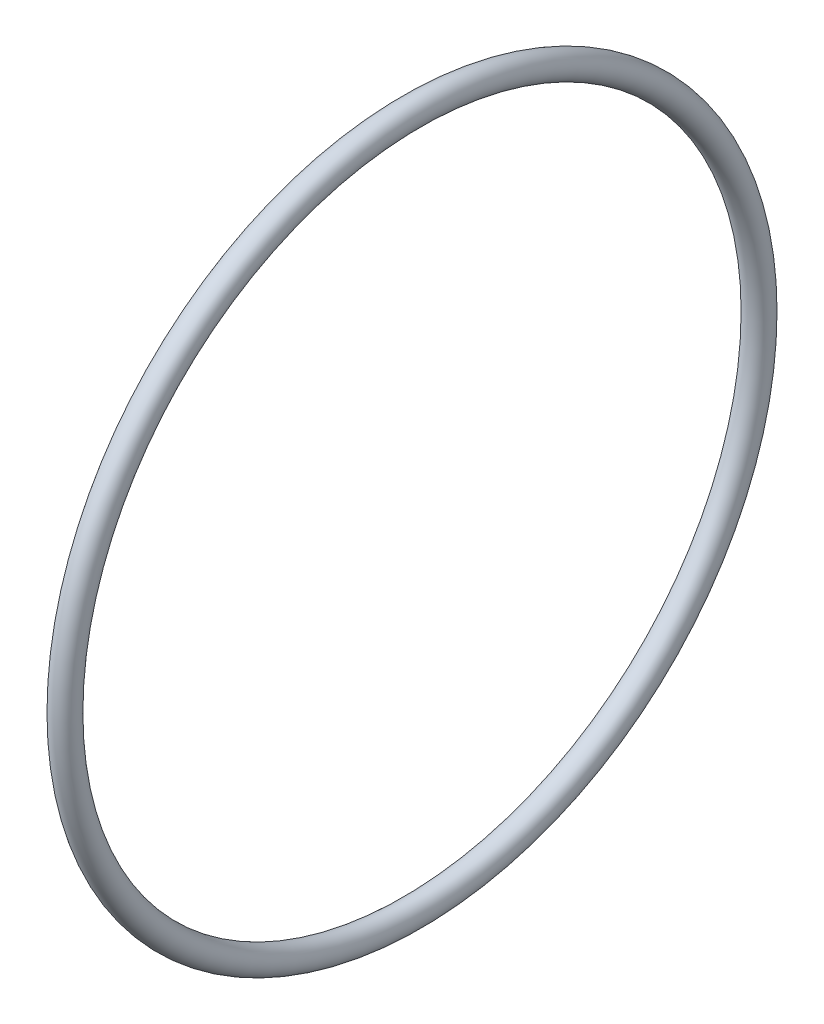
from build123d import *

# Parameters (mm, degrees)
SKETCH3_R = 0.950000005


with BuildPart() as part:
    # Sketch3 → Revolve1 (revolve)
    with BuildSketch(Plane.XY):
        with Locations((26.880400265, 25.950000043)):
            Circle(SKETCH3_R)
    revolve(axis=Axis((0, 0, 0), (1, 0, 0)))


solid = part.part
